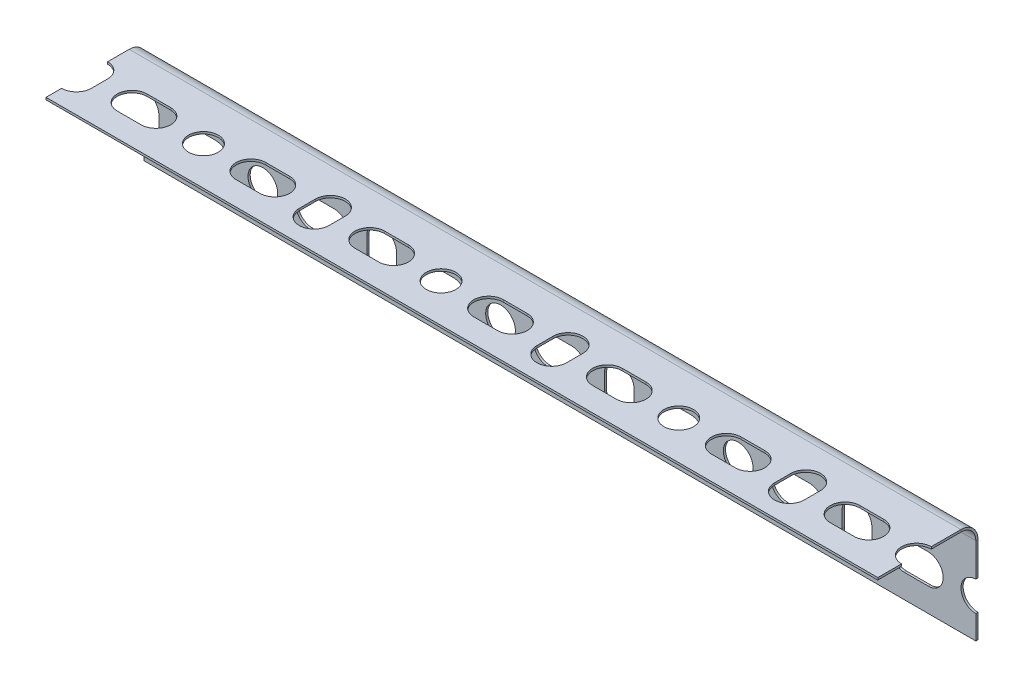
from build123d import *

# Parameters (mm, degrees)
SKETCH1_W                    = 280
SKETCH1_H                    = 0.7366
BASE_FLANGE1_DEPTH           = 35
EDGE_FLANGE1_STRIP_W         = 12.9464
EDGE_FLANGE1_STRIP_H         = 0.7366
EDGE_FLANGE1_STRIP_CUT_DEPTH = 280
EDGE_FLANGE1_DEPTH           = 280
SKETCH11_R                   = 5
CUT_EXTRUDE1_DEPTH           = 149.199723952
LPATTERN1_COUNT              = 14
LPATTERN1_PITCH              = 80
SKETCH12_R                   = 5
CUT_EXTRUDE2_DEPTH           = 35
LPATTERN2_COUNT              = 15
LPATTERN2_PITCH              = 80


# Sheet-metal steps are written as plain solids
with BuildPart() as part:
    # Sketch1 → Base-Flange1 (new body)
    with BuildSketch(Plane(origin=(0, 0, 0), x_dir=(1, 0, 0), z_dir=(0, 1, 0))):
        with Locations((0, -0.3683)):
            Rectangle(SKETCH1_W, SKETCH1_H)
    extrude(amount=BASE_FLANGE1_DEPTH)

    # Edge-Flange1 strip (across the edge) → Edge-Flange1 strip cut (cut)
    with BuildSketch(Plane(origin=(140, 35, 0.7366), x_dir=(0, -1, 0), z_dir=(-1, 0, 0))):
        with Locations((-0.7366, -0.3683)):
            Rectangle(EDGE_FLANGE1_STRIP_W, EDGE_FLANGE1_STRIP_H)
    extrude(amount=EDGE_FLANGE1_STRIP_CUT_DEPTH, mode=Mode.SUBTRACT)

    # Edge-Flange1 section (across the edge) → Edge-Flange1 (add)
    with BuildSketch(Plane(origin=(140, 35, 0.7366), x_dir=(0, -1, 0), z_dir=(-1, 0, 0))):
        with BuildLine():
            Line((0, 5), (0, 33))
            Line((0, 33), (0.7366, 33))
            Line((0.7366, 33), (0.7366, 5))
            ThreePointArc((0.7366, 5), (2.201066094, 1.464466094), (5.7366, 0))
            Line((5.7366, 0), (5.7366, -0.7366))
            ThreePointArc((5.7366, -0.7366), (1.680211239, 0.943611239), (0, 5))
        make_face()
    extrude(amount=EDGE_FLANGE1_DEPTH)

    # Sketch11 → Cut-Extrude1 (cut, through all)
    with BuildSketch(Plane(origin=(0, 35, 0), x_dir=(1, 0, 0), z_dir=(0, 1, 0))):
        with Locations((140, -20.7366)):
            Circle(SKETCH11_R)
        with BuildLine():
            Line((124, -25.7366), (116, -25.7366))
            ThreePointArc((116, -25.7366), (111, -20.7366), (116, -15.7366))
            Line((116, -15.7366), (124, -15.7366))
            ThreePointArc((124, -15.7366), (129, -20.7366), (124, -25.7366))
        make_face()
        with BuildLine():
            Line((84, -25.7366), (76, -25.7366))
            ThreePointArc((76, -25.7366), (71, -20.7366), (76, -15.7366))
            Line((76, -15.7366), (84, -15.7366))
            ThreePointArc((84, -15.7366), (89, -20.7366), (84, -25.7366))
        make_face()
        with BuildLine():
            Line((95, -23.4866), (95, -17.9866))
            ThreePointArc((95, -17.9866), (100, -12.9866), (105, -17.9866))
            Line((105, -17.9866), (105, -23.4866))
            ThreePointArc((105, -23.4866), (100, -28.4866), (95, -23.4866))
        make_face()
    cut_extrude1 = extrude(amount=-CUT_EXTRUDE1_DEPTH, mode=Mode.SUBTRACT)

    # LPattern1: Cut-Extrude1 ×14
    with Locations(*[(-i * LPATTERN1_PITCH, 0, 0) for i in range(1, LPATTERN1_COUNT)]):
        add(cut_extrude1, mode=Mode.SUBTRACT)

    # Sketch12 → Cut-Extrude2 (cut)
    with BuildSketch(Plane.XY.offset(0.7366)):
        with Locations((140, 13)):
            Circle(SKETCH12_R)
        with BuildLine():
            Line((124, 8), (116, 8))
            ThreePointArc((116, 8), (111, 13), (116, 18))
            Line((116, 18), (124, 18))
            ThreePointArc((124, 18), (129, 13), (124, 8))
        make_face()
        with BuildLine():
            Line((95, 10.25), (95, 15.75))
            ThreePointArc((95, 15.75), (100, 20.75), (105, 15.75))
            Line((105, 15.75), (105, 10.25))
            ThreePointArc((105, 10.25), (100, 5.25), (95, 10.25))
        make_face()
        with BuildLine():
            Line((84, 8), (76, 8))
            ThreePointArc((76, 8), (71, 13), (76, 18))
            Line((76, 18), (84, 18))
            ThreePointArc((84, 18), (89, 13), (84, 8))
        make_face()
    cut_extrude2 = extrude(amount=-CUT_EXTRUDE2_DEPTH, mode=Mode.SUBTRACT)

    # LPattern2: Cut-Extrude2 ×15
    with Locations(*[(-i * LPATTERN2_PITCH, 0, 0) for i in range(1, LPATTERN2_COUNT)]):
        add(cut_extrude2, mode=Mode.SUBTRACT)


solid = part.part
